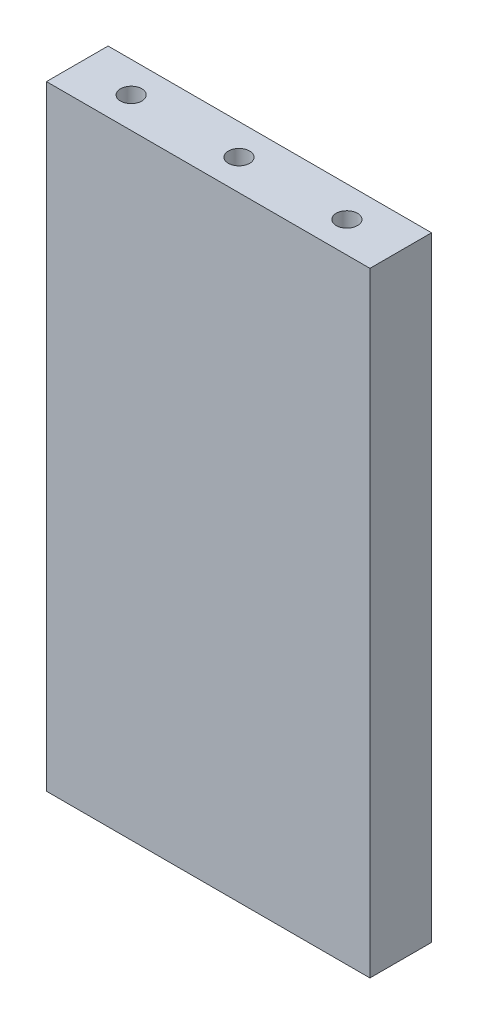
from build123d import *

# Parameters (mm, degrees)
SKETCH1_W                 = 50
SKETCH1_H                 = 95
BOSS_EXTRUDE1_DEPTH       = 9.525
M4X0_7_TAPPED_HOLE1_D     = 3.3
M4X0_7_TAPPED_HOLE1_DEPTH = 10
M4X0_7_TAPPED_HOLE1_TIP   = 0.991420021
M4X0_7_TAPPED_HOLE2_D     = 3.3
M4X0_7_TAPPED_HOLE2_DEPTH = 10
M4X0_7_TAPPED_HOLE2_TIP   = 0.991420021


with BuildPart() as part:
    # Sketch1 → Boss-Extrude1 (new body)
    with BuildSketch(Plane.XY):
        Rectangle(SKETCH1_W, SKETCH1_H)
    extrude(amount=-BOSS_EXTRUDE1_DEPTH)

    # M4x0.7 Tapped Hole1
    with Locations(Plane.XZ.offset(47.5)):
        with Locations((16.67, -4.7625), (0, -4.7625), (-16.67, -4.7625)):
            Hole(M4X0_7_TAPPED_HOLE1_D / 2, depth=M4X0_7_TAPPED_HOLE1_DEPTH)
            with Locations((0, 0, -(M4X0_7_TAPPED_HOLE1_DEPTH + M4X0_7_TAPPED_HOLE1_TIP / 2))):  # 118° drill point
                Cone(0, M4X0_7_TAPPED_HOLE1_D / 2, M4X0_7_TAPPED_HOLE1_TIP, mode=Mode.SUBTRACT)

    # M4x0.7 Tapped Hole2
    with Locations(Plane(origin=(0, 47.5, 0), x_dir=(1, 0, 0), z_dir=(0, 1, 0))):
        with Locations((0, 4.7625), (16.67, 4.7625), (-16.67, 4.7625)):
            Hole(M4X0_7_TAPPED_HOLE2_D / 2, depth=M4X0_7_TAPPED_HOLE2_DEPTH)
            with Locations((0, 0, -(M4X0_7_TAPPED_HOLE2_DEPTH + M4X0_7_TAPPED_HOLE2_TIP / 2))):  # 118° drill point
                Cone(0, M4X0_7_TAPPED_HOLE2_D / 2, M4X0_7_TAPPED_HOLE2_TIP, mode=Mode.SUBTRACT)


solid = part.part
